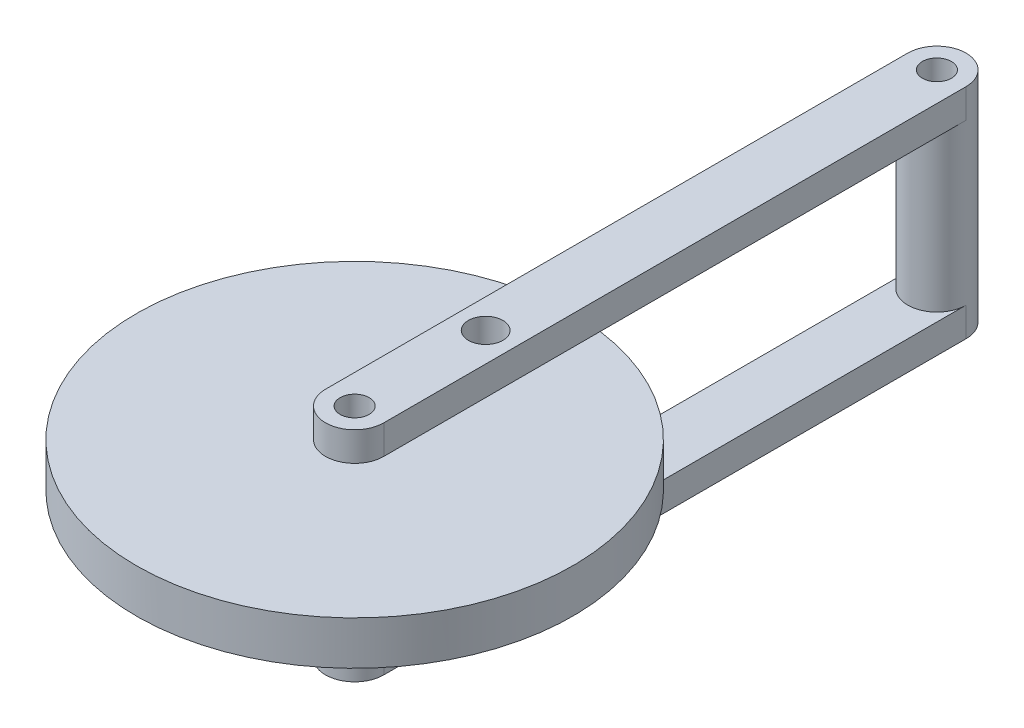
from build123d import *
from build123d.topology import SkipClean

# Parameters (mm, degrees)
BOSS_EXTRUDE1_DEPTH             = 2
SKETCH2_R                       = 2
BOSS_EXTRUDE2_DEPTH             = 12
BOSS_EXTRUDE3_START             = 13
BOSS_EXTRUDE3_DEPTH             = 2
SKETCH7_R                       = 15
BOSS_EXTRUDE5_DEPTH             = 3
F_2_0MM_CLEARANCE_DOWEL_HOLE1_D = 2
F_4_48_TAPPED_HOLE1_D           = 2.3749
F_4_48_TAPPED_HOLE1_DEPTH       = 7.27
F_4_48_TAPPED_HOLE1_TIP         = 0.713491942


with BuildPart() as part:
    # Sketch1 → Boss-Extrude1 (new body)
    with BuildSketch(Plane(origin=(0, 0, 0), x_dir=(1, 0, 0), z_dir=(0, 1, 0))):
        with BuildLine():
            Line((2, 0), (2, -40))
            ThreePointArc((2, -40), (0, -42), (-2, -40))
            Line((-2, -40), (-2, 0))
            ThreePointArc((-2, 0), (0, 2), (2, 0))
        make_face()
    extrude(amount=BOSS_EXTRUDE1_DEPTH)

    # Sketch2 → Boss-Extrude2 (add)
    with SkipClean():  # the faces are left unmerged after this step: merging them gives an invalid solid
        with BuildSketch(Plane(origin=(0, 2, 0), x_dir=(1, 0, 0), z_dir=(0, 1, 0))):
            Circle(SKETCH2_R)
        extrude(amount=BOSS_EXTRUDE2_DEPTH)
    add(part.part.scale(1), mode=Mode.REPLACE)  # the faces are merged on a copy

    # Sketch1<3> → Boss-Extrude3 (add)
    with BuildSketch(Plane(origin=(0, 0, 0), x_dir=(1, 0, 0), z_dir=(0, 1, 0)).offset(BOSS_EXTRUDE3_START)):
        with BuildLine():
            Line((2, 0), (2, -40))
            ThreePointArc((2, -40), (0, -42), (-2, -40))
            Line((-2, -40), (-2, 0))
            ThreePointArc((-2, 0), (0, 2), (2, 0))
        make_face()
    extrude(amount=BOSS_EXTRUDE3_DEPTH)

    # Sketch7 → Boss-Extrude5 (add)
    with BuildSketch(Plane.XZ.offset(-13)):
        with Locations((0, 40)):
            Circle(SKETCH7_R)
    extrude(amount=BOSS_EXTRUDE5_DEPTH)

    # Ø2.0mm Clearance Dowel Hole1 (through all)
    with Locations(Plane(origin=(0, 15, 0), x_dir=(1, 0, 0), z_dir=(0, 1, 0))):
        with Locations((0, 0), (0, -40)):
            Hole(F_2_0MM_CLEARANCE_DOWEL_HOLE1_D / 2)

    # #4-48 Tapped Hole1
    with Locations(Plane(origin=(0, 15, 0), x_dir=(1, 0, 0), z_dir=(0, 1, 0))):
        with Locations((0, -31)):
            Hole(F_4_48_TAPPED_HOLE1_D / 2, depth=F_4_48_TAPPED_HOLE1_DEPTH)
            with Locations((0, 0, -(F_4_48_TAPPED_HOLE1_DEPTH + F_4_48_TAPPED_HOLE1_TIP / 2))):  # 118° drill point
                Cone(0, F_4_48_TAPPED_HOLE1_D / 2, F_4_48_TAPPED_HOLE1_TIP, mode=Mode.SUBTRACT)


solid = part.part
